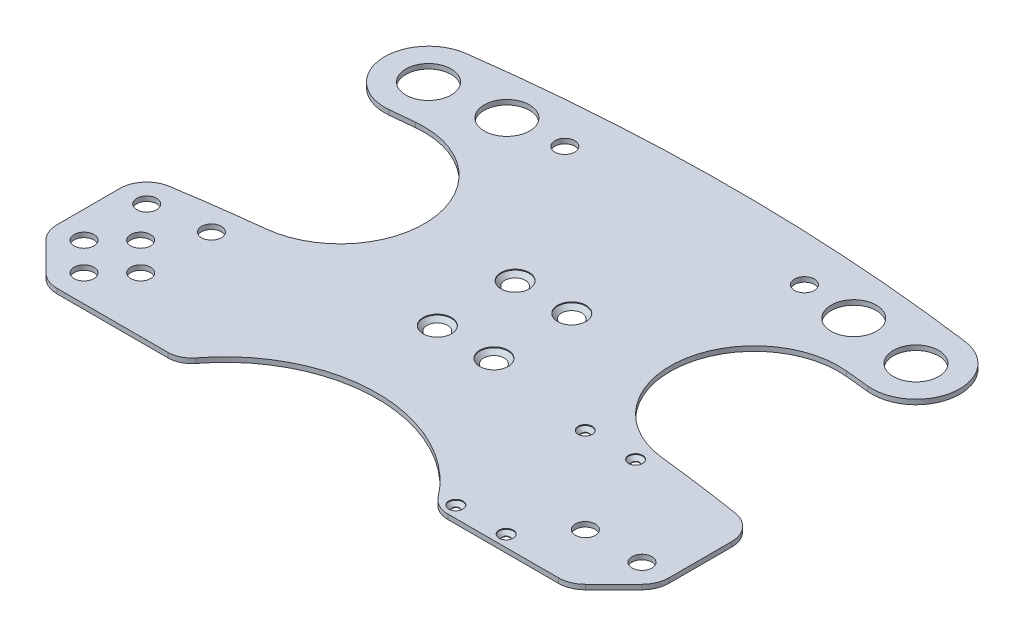
from build123d import *

# Parameters (mm, degrees)
SKETCH1_R                                      = 2.5
BOSS_EXTRUDE1_DEPTH                            = 1.7
CUT_EXTRUDE1_REACH                             = 155.062
SKETCH2_R                                      = 3.5
SKETCH2_R_2                                    = 8
CUT_EXTRUDE2_REACH                             = 155.062
SKETCH3_R                                      = 1.3
CSK_FOR_M5_FLAT_HEAD_MACHINE_SCREW1_AT_2_COUNT = 2
CSK_FOR_M5_FLAT_HEAD_MACHINE_SCREW1_AT_2_PITCH = 20
CSK_FOR_M5_FLAT_HEAD_MACHINE_SCREW1_AT_3_COUNT = 2
CSK_FOR_M5_FLAT_HEAD_MACHINE_SCREW1_AT_3_PITCH = 34.003676272
CSK_FOR_M5_FLAT_HEAD_MACHINE_SCREW1_AT_4_COUNT = 2
CSK_FOR_M5_FLAT_HEAD_MACHINE_SCREW1_AT_4_PITCH = 27.5
CSK_FOR_M2_5_FLAT_HEAD_MACHINE_SCREW1_AT_COUNT = 2
CSK_FOR_M2_5_FLAT_HEAD_MACHINE_SCREW1_AT_PITCH = 17.78
CSK_FOR_M2_5_FLAT_HEAD_MACHINE_SCREW_2_COUNT   = 2
CSK_FOR_M2_5_FLAT_HEAD_MACHINE_SCREW_2_PITCH   = 49.055548106
CSK_FOR_M2_5_FLAT_HEAD_MACHINE_SCREW_3_COUNT   = 2
CSK_FOR_M2_5_FLAT_HEAD_MACHINE_SCREW_3_PITCH   = 45.72
FILLET1_R                                      = 8.5


with BuildPart() as part:
    # Sketch1 → Boss-Extrude1 (new body)
    with BuildSketch(Plane(origin=(0, 0, 0), x_dir=(1, 0, 0), z_dir=(0, 1, 0))):
        with BuildLine():
            Line((-73.314391493, -95), (73.314391493, -95))
            ThreePointArc((73.314391493, -95), (120, 0), (73.314391493, 95))
            Line((73.314391493, 95), (-73.314391493, 95))
            ThreePointArc((-73.314391493, 95), (-120, 0), (-73.314391493, -95))
        make_face()
        with Locations((-10, 13.75)):
            Circle(SKETCH1_R, mode=Mode.SUBTRACT)
        with Locations((-10, -13.75)):
            Circle(SKETCH1_R, mode=Mode.SUBTRACT)
        with Locations((10, -13.75)):
            Circle(SKETCH1_R, mode=Mode.SUBTRACT)
        with Locations((10, 13.75)):
            Circle(SKETCH1_R, mode=Mode.SUBTRACT)
    extrude(amount=BOSS_EXTRUDE1_DEPTH)

    # Sketch2 → Cut-Extrude1 (cut, up to next)
    with BuildSketch(Plane(origin=(0, 1.7, 0), x_dir=(1, 0, 0), z_dir=(0, 1, 0)), mode=Mode.PRIVATE) as cut_extrude1_sk1:
        with Locations((-88.540600769, -40)):
            Circle(SKETCH2_R)
    cut_extrude1_tool1 = extrude(cut_extrude1_sk1.sketch, amount=-CUT_EXTRUDE1_REACH, mode=Mode.PRIVATE) & part.part
    # Sketch2 → Cut-Extrude1 (cut, up to next)
    with BuildSketch(Plane(origin=(0, 1.7, 0), x_dir=(1, 0, 0), z_dir=(0, 1, 0)), mode=Mode.PRIVATE) as cut_extrude1_sk2:
        with Locations((-78.540600769, -50)):
            Circle(SKETCH2_R)
    cut_extrude1_tool2 = extrude(cut_extrude1_sk2.sketch, amount=-CUT_EXTRUDE1_REACH, mode=Mode.PRIVATE) & part.part
    # Sketch2 → Cut-Extrude1 (cut, up to next)
    with BuildSketch(Plane(origin=(0, 1.7, 0), x_dir=(1, 0, 0), z_dir=(0, 1, 0)), mode=Mode.PRIVATE) as cut_extrude1_sk3:
        with Locations((-88.540600769, -60)):
            Circle(SKETCH2_R)
    cut_extrude1_tool3 = extrude(cut_extrude1_sk3.sketch, amount=-CUT_EXTRUDE1_REACH, mode=Mode.PRIVATE) & part.part
    # Sketch2 → Cut-Extrude1 (cut, up to next)
    with BuildSketch(Plane(origin=(0, 1.7, 0), x_dir=(1, 0, 0), z_dir=(0, 1, 0)), mode=Mode.PRIVATE) as cut_extrude1_sk4:
        with Locations((-98.540600769, -50)):
            Circle(SKETCH2_R)
    cut_extrude1_tool4 = extrude(cut_extrude1_sk4.sketch, amount=-CUT_EXTRUDE1_REACH, mode=Mode.PRIVATE) & part.part
    # Sketch2 → Cut-Extrude1 (cut, up to next)
    with BuildSketch(Plane(origin=(0, 1.7, 0), x_dir=(1, 0, 0), z_dir=(0, 1, 0)), mode=Mode.PRIVATE) as cut_extrude1_sk5:
        with Locations((78.540600769, -50)):
            Circle(SKETCH2_R)
    cut_extrude1_tool5 = extrude(cut_extrude1_sk5.sketch, amount=-CUT_EXTRUDE1_REACH, mode=Mode.PRIVATE) & part.part
    # Sketch2 → Cut-Extrude1 (cut, up to next)
    with BuildSketch(Plane(origin=(0, 1.7, 0), x_dir=(1, 0, 0), z_dir=(0, 1, 0)), mode=Mode.PRIVATE) as cut_extrude1_sk6:
        with Locations((98.540600769, -50)):
            Circle(SKETCH2_R)
    cut_extrude1_tool6 = extrude(cut_extrude1_sk6.sketch, amount=-CUT_EXTRUDE1_REACH, mode=Mode.PRIVATE) & part.part
    # Sketch2 → Cut-Extrude1 (cut, up to next)
    with BuildSketch(Plane(origin=(0, 1.7, 0), x_dir=(1, 0, 0), z_dir=(0, 1, 0)), mode=Mode.PRIVATE) as cut_extrude1_sk7:
        with Locations((-98.540600769, -27.862546721)):
            Circle(SKETCH2_R)
    cut_extrude1_tool7 = extrude(cut_extrude1_sk7.sketch, amount=-CUT_EXTRUDE1_REACH, mode=Mode.PRIVATE) & part.part
    # Sketch2 → Cut-Extrude1 (cut, up to next)
    with BuildSketch(Plane(origin=(0, 1.7, 0), x_dir=(1, 0, 0), z_dir=(0, 1, 0)), mode=Mode.PRIVATE) as cut_extrude1_sk8:
        with Locations((-78.540600769, -25)):
            Circle(SKETCH2_R)
    cut_extrude1_tool8 = extrude(cut_extrude1_sk8.sketch, amount=-CUT_EXTRUDE1_REACH, mode=Mode.PRIVATE) & part.part
    # Sketch2 → Cut-Extrude1 (cut, up to next)
    with BuildSketch(Plane(origin=(0, 1.7, 0), x_dir=(1, 0, 0), z_dir=(0, 1, 0)), mode=Mode.PRIVATE) as cut_extrude1_sk9:
        with Locations((-86.094520408, 59.228232759)):
            Circle(SKETCH2_R_2)
    cut_extrude1_tool9 = extrude(cut_extrude1_sk9.sketch, amount=-CUT_EXTRUDE1_REACH, mode=Mode.PRIVATE) & part.part
    # Sketch2 → Cut-Extrude1 (cut, up to next)
    with BuildSketch(Plane(origin=(0, 1.7, 0), x_dir=(1, 0, 0), z_dir=(0, 1, 0)), mode=Mode.PRIVATE) as cut_extrude1_sk10:
        with Locations((-61.259580586, 62.084312054)):
            Circle(SKETCH2_R_2)
    cut_extrude1_tool10 = extrude(cut_extrude1_sk10.sketch, amount=-CUT_EXTRUDE1_REACH, mode=Mode.PRIVATE) & part.part
    # Sketch2 → Cut-Extrude1 (cut, up to next)
    with BuildSketch(Plane(origin=(0, 1.7, 0), x_dir=(1, 0, 0), z_dir=(0, 1, 0)), mode=Mode.PRIVATE) as cut_extrude1_sk11:
        with Locations((61.259580586, 62.084312054)):
            Circle(SKETCH2_R_2)
    cut_extrude1_tool11 = extrude(cut_extrude1_sk11.sketch, amount=-CUT_EXTRUDE1_REACH, mode=Mode.PRIVATE) & part.part
    # Sketch2 → Cut-Extrude1 (cut, up to next)
    with BuildSketch(Plane(origin=(0, 1.7, 0), x_dir=(1, 0, 0), z_dir=(0, 1, 0)), mode=Mode.PRIVATE) as cut_extrude1_sk12:
        with Locations((86.094520408, 59.228232759)):
            Circle(SKETCH2_R_2)
    cut_extrude1_tool12 = extrude(cut_extrude1_sk12.sketch, amount=-CUT_EXTRUDE1_REACH, mode=Mode.PRIVATE) & part.part
    # Sketch2 → Cut-Extrude1 (cut, up to next)
    with BuildSketch(Plane(origin=(0, 1.7, 0), x_dir=(1, 0, 0), z_dir=(0, 1, 0)), mode=Mode.PRIVATE) as cut_extrude1_sk13:
        with Locations((-42.320942156, 63.610082158)):
            Circle(SKETCH2_R)
    cut_extrude1_tool13 = extrude(cut_extrude1_sk13.sketch, amount=-CUT_EXTRUDE1_REACH, mode=Mode.PRIVATE) & part.part
    # Sketch2 → Cut-Extrude1 (cut, up to next)
    with BuildSketch(Plane(origin=(0, 1.7, 0), x_dir=(1, 0, 0), z_dir=(0, 1, 0)), mode=Mode.PRIVATE) as cut_extrude1_sk14:
        with Locations((42.320942156, 63.610082158)):
            Circle(SKETCH2_R)
    cut_extrude1_tool14 = extrude(cut_extrude1_sk14.sketch, amount=-CUT_EXTRUDE1_REACH, mode=Mode.PRIVATE) & part.part
    add(cut_extrude1_tool1.solids().sort_by_distance((-88.540601, 1.7, 40))[0], mode=Mode.SUBTRACT)
    add(cut_extrude1_tool2.solids().sort_by_distance((-78.540601, 1.7, 50))[0], mode=Mode.SUBTRACT)
    add(cut_extrude1_tool3.solids().sort_by_distance((-88.540601, 1.7, 60))[0], mode=Mode.SUBTRACT)
    add(cut_extrude1_tool4.solids().sort_by_distance((-98.540601, 1.7, 50))[0], mode=Mode.SUBTRACT)
    add(cut_extrude1_tool5.solids().sort_by_distance((78.540601, 1.7, 50))[0], mode=Mode.SUBTRACT)
    add(cut_extrude1_tool6.solids().sort_by_distance((98.540601, 1.7, 50))[0], mode=Mode.SUBTRACT)
    add(cut_extrude1_tool7.solids().sort_by_distance((-98.540601, 1.7, 27.862547))[0], mode=Mode.SUBTRACT)
    add(cut_extrude1_tool8.solids().sort_by_distance((-78.540601, 1.7, 25))[0], mode=Mode.SUBTRACT)
    add(cut_extrude1_tool9.solids().sort_by_distance((-86.09452, 1.7, -59.228233))[0], mode=Mode.SUBTRACT)
    add(cut_extrude1_tool10.solids().sort_by_distance((-61.259581, 1.7, -62.084312))[0], mode=Mode.SUBTRACT)
    add(cut_extrude1_tool11.solids().sort_by_distance((61.259581, 1.7, -62.084312))[0], mode=Mode.SUBTRACT)
    add(cut_extrude1_tool12.solids().sort_by_distance((86.09452, 1.7, -59.228233))[0], mode=Mode.SUBTRACT)
    add(cut_extrude1_tool13.solids().sort_by_distance((-42.320942, 1.7, -63.610082))[0], mode=Mode.SUBTRACT)
    add(cut_extrude1_tool14.solids().sort_by_distance((42.320942, 1.7, -63.610082))[0], mode=Mode.SUBTRACT)

    # Sketch3 → Cut-Extrude2 (cut, up to next)
    with BuildSketch(Plane(origin=(0, 1.7, 0), x_dir=(1, 0, 0), z_dir=(0, 1, 0)), mode=Mode.PRIVATE) as cut_extrude2_sk1:
        with BuildLine():
            Line((-76.105927639, 44.650651409), (-84.550645906, 43.805313077))
            ThreePointArc((-84.550645906, 43.805313077), (-99.436668511, 51.3391844), (-98.864520746, 68.013282068))
            ThreePointArc((-98.864520746, 68.013282068), (-119.734623685, 7.97620781), (-107.012417284, -54.298642221))
            ThreePointArc((-107.012417284, -54.298642221), (-107.779979993, -52.209948315), (-108.040600769, -50))
            Line((-108.040600769, -50), (-108.040600769, -27.862546721))
            ThreePointArc((-108.040600769, -27.862546721), (-105.768300058, -21.697292226), (-100.038419088, -18.48136661))
            ThreePointArc((-100.038419088, -18.48136661), (-84.982869073, -16.262381047), (-69.878431936, -14.405108326))
            ThreePointArc((-69.878431936, -14.405108326), (-43.620166551, 18.220083083), (-76.105927639, 44.650651409))
        make_face()
    cut_extrude2_tool1 = extrude(cut_extrude2_sk1.sketch, amount=-CUT_EXTRUDE2_REACH, mode=Mode.PRIVATE) & part.part
    # Sketch3 → Cut-Extrude2 (cut, up to next)
    with BuildSketch(Plane(origin=(0, 1.7, 0), x_dir=(1, 0, 0), z_dir=(0, 1, 0)), mode=Mode.PRIVATE) as cut_extrude2_sk2:
        with BuildLine():
            ThreePointArc((-98.864520746, 68.013282068), (-94.209947077, 72.433907674), (-88.163438842, 74.589534022))
            ThreePointArc((-88.163438842, 74.589534022), (2.1e-08, 80.5), (88.163438884, 74.589534017))
            ThreePointArc((88.163438884, 74.589534017), (94.209947407, 72.433907471), (98.864521161, 68.013281465))
            ThreePointArc((98.864521161, 68.013281465), (87.140491363, 82.50172583), (73.314391493, 95))
            Line((73.314391493, 95), (-73.314391493, 95))
            ThreePointArc((-73.314391493, 95), (-87.140491112, 82.501726096), (-98.864520746, 68.013282068))
        make_face()
    cut_extrude2_tool2 = extrude(cut_extrude2_sk2.sketch, amount=-CUT_EXTRUDE2_REACH, mode=Mode.PRIVATE) & part.part
    # Sketch3 → Cut-Extrude2 (cut, up to next)
    with BuildSketch(Plane(origin=(0, 1.7, 0), x_dir=(1, 0, 0), z_dir=(0, 1, 0)), mode=Mode.PRIVATE) as cut_extrude2_sk3:
        with BuildLine():
            ThreePointArc((-105.258115191, -56.717514421), (-106.230963521, -55.577483371), (-107.012417284, -54.298642221))
            ThreePointArc((-107.012417284, -54.298642221), (-92.431540192, -76.527187181), (-73.314391493, -95))
            Line((-73.314391493, -95), (73.314391493, -95))
            ThreePointArc((73.314391493, -95), (92.431540082, -76.527187314), (107.012417128, -54.298642528))
            ThreePointArc((107.012417128, -54.298642528), (106.23096342, -55.57748351), (105.258115191, -56.717514421))
            Line((105.258115191, -56.717514421), (95.258115191, -66.717514421))
            ThreePointArc((95.258115191, -66.717514421), (92.176093377, -68.776855559), (88.540600769, -69.5))
            Line((88.540600769, -69.5), (45.040600769, -69.5))
            ThreePointArc((45.040600769, -69.5), (0, -45), (-45.040600769, -69.5))
            Line((-45.040600769, -69.5), (-88.540600769, -69.5))
            ThreePointArc((-88.540600769, -69.5), (-92.176093377, -68.776855559), (-95.258115191, -66.717514421))
            Line((-95.258115191, -66.717514421), (-105.258115191, -56.717514421))
        make_face()
    cut_extrude2_tool3 = extrude(cut_extrude2_sk3.sketch, amount=-CUT_EXTRUDE2_REACH, mode=Mode.PRIVATE) & part.part
    # Sketch3 → Cut-Extrude2 (cut, up to next)
    with BuildSketch(Plane(origin=(0, 1.7, 0), x_dir=(1, 0, 0), z_dir=(0, 1, 0)), mode=Mode.PRIVATE) as cut_extrude2_sk4:
        with BuildLine():
            ThreePointArc((69.878433596, -14.40510851), (84.982869339, -16.262381083), (100.038417968, -18.481366431))
            ThreePointArc((100.038417968, -18.481366431), (105.768299691, -21.697291795), (108.040600769, -27.862546721))
            Line((108.040600769, -27.862546721), (108.040600769, -50))
            ThreePointArc((108.040600769, -50), (107.779979953, -52.209948483), (107.012417128, -54.298642528))
            ThreePointArc((107.012417128, -54.298642528), (119.734623721, 7.976207273), (98.864521161, 68.013281465))
            ThreePointArc((98.864521161, 68.013281465), (99.436668324, 51.339184085), (84.550645906, 43.805313077))
            Line((84.550645906, 43.805313077), (76.105927251, 44.650651448))
            ThreePointArc((76.105927251, 44.650651448), (43.620166443, 18.220082059), (69.878433596, -14.40510851))
        make_face()
    cut_extrude2_tool4 = extrude(cut_extrude2_sk4.sketch, amount=-CUT_EXTRUDE2_REACH, mode=Mode.PRIVATE) & part.part
    # Sketch3 → Cut-Extrude2 (cut, up to next)
    with BuildSketch(Plane(origin=(0, 1.7, 0), x_dir=(1, 0, 0), z_dir=(0, 1, 0)), mode=Mode.PRIVATE) as cut_extrude2_sk5:
        with Locations((48.150600769, -19.64)):
            Circle(SKETCH3_R)
    cut_extrude2_tool5 = extrude(cut_extrude2_sk5.sketch, amount=-CUT_EXTRUDE2_REACH, mode=Mode.PRIVATE) & part.part
    # Sketch3 → Cut-Extrude2 (cut, up to next)
    with BuildSketch(Plane(origin=(0, 1.7, 0), x_dir=(1, 0, 0), z_dir=(0, 1, 0)), mode=Mode.PRIVATE) as cut_extrude2_sk6:
        with Locations((65.930600769, -19.64)):
            Circle(SKETCH3_R)
    cut_extrude2_tool6 = extrude(cut_extrude2_sk6.sketch, amount=-CUT_EXTRUDE2_REACH, mode=Mode.PRIVATE) & part.part
    # Sketch3 → Cut-Extrude2 (cut, up to next)
    with BuildSketch(Plane(origin=(0, 1.7, 0), x_dir=(1, 0, 0), z_dir=(0, 1, 0)), mode=Mode.PRIVATE) as cut_extrude2_sk7:
        with Locations((65.930600769, -65.36)):
            Circle(SKETCH3_R)
    cut_extrude2_tool7 = extrude(cut_extrude2_sk7.sketch, amount=-CUT_EXTRUDE2_REACH, mode=Mode.PRIVATE) & part.part
    # Sketch3 → Cut-Extrude2 (cut, up to next)
    with BuildSketch(Plane(origin=(0, 1.7, 0), x_dir=(1, 0, 0), z_dir=(0, 1, 0)), mode=Mode.PRIVATE) as cut_extrude2_sk8:
        with Locations((48.150600769, -65.36)):
            Circle(SKETCH3_R)
    cut_extrude2_tool8 = extrude(cut_extrude2_sk8.sketch, amount=-CUT_EXTRUDE2_REACH, mode=Mode.PRIVATE) & part.part
    add(cut_extrude2_tool1.solids().sort_by_distance((-86.043963, 1.7, -12.513289))[0], mode=Mode.SUBTRACT)
    add(cut_extrude2_tool2.solids().sort_by_distance((0, 1.7, -86.177495))[0], mode=Mode.SUBTRACT)
    add(cut_extrude2_tool3.solids().sort_by_distance((0, 1.7, 75.736765))[0], mode=Mode.SUBTRACT)
    add(cut_extrude2_tool4.solids().sort_by_distance((86.043963, 1.7, -12.513289))[0], mode=Mode.SUBTRACT)
    add(cut_extrude2_tool5.solids().sort_by_distance((48.150601, 1.7, 19.64))[0], mode=Mode.SUBTRACT)
    add(cut_extrude2_tool6.solids().sort_by_distance((65.930601, 1.7, 19.64))[0], mode=Mode.SUBTRACT)
    add(cut_extrude2_tool7.solids().sort_by_distance((65.930601, 1.7, 65.36))[0], mode=Mode.SUBTRACT)
    add(cut_extrude2_tool8.solids().sort_by_distance((48.150601, 1.7, 65.36))[0], mode=Mode.SUBTRACT)

    # Sketch5 → CSK for M5 Flat Head Machine Screw1 (revolve, cut)
    with BuildSketch(Plane(origin=(-10, 1.7, -13.75), x_dir=(0, 0, 1), z_dir=(1, 0, 0))):
        Polygon((0, 0), (0, 6.502151548), (2.5, 5), (2.5, 2.8), (5, 0.3), (5, 0), align=None)
    csk_for_m5_flat_head_machine_screw1 = revolve(axis=Axis((-10, 8.05, -13.75), (0, -1, 0)), mode=Mode.SUBTRACT)

    # CSK for M5 Flat Head Machine Screw1 at 2: CSK for M5 Flat Head Machine Screw1 ×2
    with Locations(*[(i * CSK_FOR_M5_FLAT_HEAD_MACHINE_SCREW1_AT_2_PITCH, 0, 0) for i in range(1, CSK_FOR_M5_FLAT_HEAD_MACHINE_SCREW1_AT_2_COUNT)]):
        add(csk_for_m5_flat_head_machine_screw1, mode=Mode.SUBTRACT)

    # CSK for M5 Flat Head Machine Screw1 at 3: CSK for M5 Flat Head Machine Screw1 ×2
    with Locations(*[Vector(0.5881716976750462, 0, 0.8087360843031886) * (i * CSK_FOR_M5_FLAT_HEAD_MACHINE_SCREW1_AT_3_PITCH) for i in range(1, CSK_FOR_M5_FLAT_HEAD_MACHINE_SCREW1_AT_3_COUNT)]):
        add(csk_for_m5_flat_head_machine_screw1, mode=Mode.SUBTRACT)

    # CSK for M5 Flat Head Machine Screw1 at 4: CSK for M5 Flat Head Machine Screw1 ×2
    with Locations(*[(0, 0, i * CSK_FOR_M5_FLAT_HEAD_MACHINE_SCREW1_AT_4_PITCH) for i in range(1, CSK_FOR_M5_FLAT_HEAD_MACHINE_SCREW1_AT_4_COUNT)]):
        add(csk_for_m5_flat_head_machine_screw1, mode=Mode.SUBTRACT)

    # Sketch7 → CSK for M2.5 Flat Head Machine Screw1 (revolve, cut)
    with BuildSketch(Plane(origin=(48.150600769, 1.7, 19.64), x_dir=(0, 0, 1), z_dir=(1, 0, 0))):
        Polygon((0, 0), (0, 5.751075774), (1.25, 5), (1.25, 1.55), (2.5, 0.3), (2.5, 0), align=None)
    csk_for_m2_5_flat_head_machine_screw1 = revolve(axis=Axis((48.150600769, 8.05, 19.64), (0, -1, 0)), mode=Mode.SUBTRACT)

    # CSK for M2.5 Flat Head Machine Screw1 at: CSK for M2.5 Flat Head Machine Screw1 ×2
    with Locations(*[(i * CSK_FOR_M2_5_FLAT_HEAD_MACHINE_SCREW1_AT_PITCH, 0, 0) for i in range(1, CSK_FOR_M2_5_FLAT_HEAD_MACHINE_SCREW1_AT_COUNT)]):
        add(csk_for_m2_5_flat_head_machine_screw1, mode=Mode.SUBTRACT)

    # CSK for M2.5 Flat Head Machine Screw 2: CSK for M2.5 Flat Head Machine Screw1 ×2
    with Locations(*[Vector(0.3624462611549487, 0, 0.9320046715412958) * (i * CSK_FOR_M2_5_FLAT_HEAD_MACHINE_SCREW_2_PITCH) for i in range(1, CSK_FOR_M2_5_FLAT_HEAD_MACHINE_SCREW_2_COUNT)]):
        add(csk_for_m2_5_flat_head_machine_screw1, mode=Mode.SUBTRACT)

    # CSK for M2.5 Flat Head Machine Screw 3: CSK for M2.5 Flat Head Machine Screw1 ×2
    with Locations(*[(0, 0, i * CSK_FOR_M2_5_FLAT_HEAD_MACHINE_SCREW_3_PITCH) for i in range(1, CSK_FOR_M2_5_FLAT_HEAD_MACHINE_SCREW_3_COUNT)]):
        add(csk_for_m2_5_flat_head_machine_screw1, mode=Mode.SUBTRACT)

    # Fillet1
    fillet1_edges = [part.edges().sort_by_distance(p)[0] for p in [
        (45.040600769, 0.85, 69.5),
        (-45.040600769, 0.85, 69.5),
    ]]
    fillet(fillet1_edges, radius=FILLET1_R)


solid = part.part
